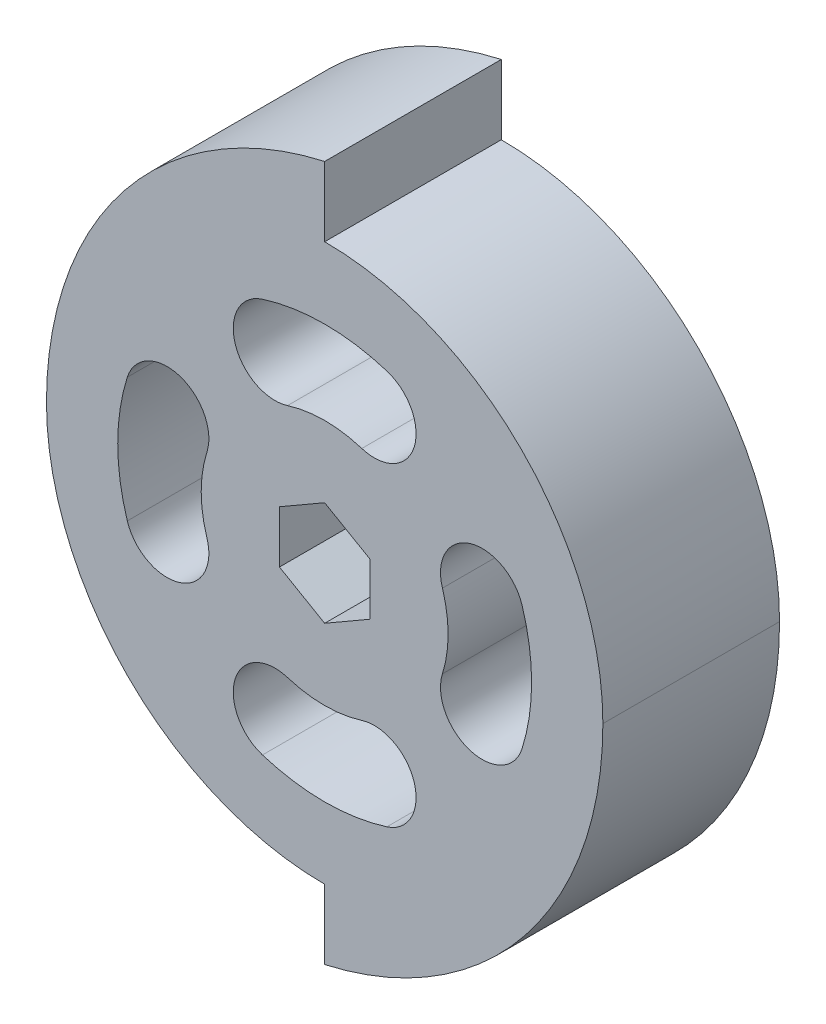
from build123d import *

# Parameters (mm, degrees)
BOSS_EXTRUDE1_DEPTH = 12.7
CUT_EXTRUDE1_DEPTH  = 35.44256088
CIRPATTERN1_COUNT   = 4


with BuildPart() as part:
    # Sketch3 → Boss-Extrude1 (new body)
    with BuildSketch(Plane.XY):
        with BuildLine():
            Line((0, 20), (0, 25))
            ThreePointArc((0, 25), (-14.384763242, 16.007810594), (-20, 0))
            ThreePointArc((-20, 0), (-14.142135624, -14.142135624), (0, -20))
            Line((0, -20), (0, -25))
            ThreePointArc((0, -25), (14.384763242, -16.007810594), (20, 0))
            ThreePointArc((20, 0), (14.142135624, 14.142135624), (0, 20))
        make_face()
        Polygon((3.25, -1.876388375), (3.25, 1.876388375), (0, 3.75277675), (-3.25, 1.876388375), (-3.25, -1.876388375), (0, -3.75277675), align=None, mode=Mode.SUBTRACT)
    extrude(amount=BOSS_EXTRUDE1_DEPTH)

    # Sketch4 → Cut-Extrude1 (cut, through all)
    with BuildSketch(Plane.XY.offset(12.7)):
        with BuildLine():
            ThreePointArc((-4.47341626, 14.187863759), (0, 14.876388375), (4.47341626, 14.187863759))
            ThreePointArc((4.47341626, 14.187863759), (6.432449714, 10.424595508), (2.669181463, 8.465562055))
            ThreePointArc((2.669181463, 8.465562055), (0, 8.876388375), (-2.669181463, 8.465562055))
            ThreePointArc((-2.669181463, 8.465562055), (-6.432449714, 10.424595508), (-4.47341626, 14.187863759))
        make_face()
    cut_extrude1 = extrude(amount=-CUT_EXTRUDE1_DEPTH, mode=Mode.SUBTRACT)

    # CirPattern1: Cut-Extrude1 ×4 about axis
    cirpattern1_axis = Axis((0, 0, -0.475), (0, 0, 1))
    for i in range(1, CIRPATTERN1_COUNT):
        add(cut_extrude1.rotate(cirpattern1_axis, i * 360 / CIRPATTERN1_COUNT), mode=Mode.SUBTRACT)


solid = part.part
